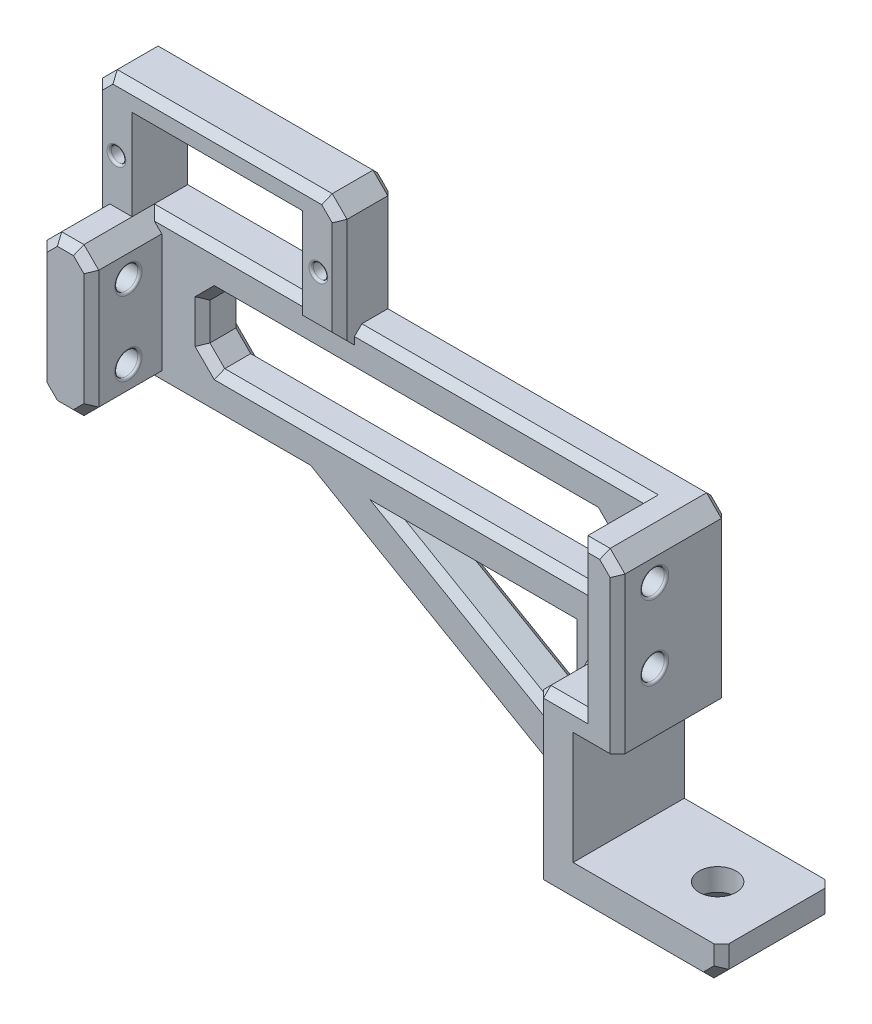
from build123d import *

# Parameters (mm, degrees)
RESSALTO_EXTRUS_O1_DEPTH  = 7.5
ESBO_O2_W                 = 33
ESBO_O2_H                 = 18.2
ESBO_O2_R                 = 0.975
ESBO_O2_W_2               = 23
ESBO_O2_H_2               = 12.2
RESSALTO_EXTRUS_O2_DEPTH  = 3
ESBO_O3_R                 = 0.975
RESSALTO_EXTRUS_O3_DEPTH  = 6
RESSALTO_EXTRUS_O4_DEPTH  = 1.5
ESBO_O6_R                 = 2.5
CORTE_EXTRUS_O1_DEPTH     = 9.5
CHANFRO1_SIZE             = 2
ESBO_O7_W                 = 15
ESBO_O7_H                 = 20
ESBO_O7_R                 = 1.6
RESSALTO_EXTRUS_O5_DEPTH  = 5
ESBO_O9_W                 = 12
ESBO_O9_H                 = 20
RESSALTO_EXTRUS_O6_DEPTH  = 2
ESBO_O10_W                = 12
ESBO_O10_H                = 20
ESBO_O10_R                = 1.55
RESSALTO_EXTRUS_O7_DEPTH  = 5
ESBO_O12_W                = 3
ESBO_O12_H                = 20
RESSALTO_EXTRUS_O11_DEPTH = 73
ESBO_O17_W                = 26
ESBO_O17_H                = 3
CORTE_EXTRUS_O2_DEPTH     = 4.5
ESBO_O18_R                = 0.975
RESSALTO_EXTRUS_O14_DEPTH = 4.5
ESBO_O19_W                = 55
ESBO_O19_H                = 9
CORTE_EXTRUS_O3_DEPTH     = 10
CHANFRO5_SIZE             = 2
RESSALTO_EXTRUS_O15_DEPTH = 3
RESSALTO_EXTRUS_O16_DEPTH = 2.5
CHANFRO8_SIZE             = 2
CHANFRO9_SIZE             = 2
CHANFRO10_SIZE            = 1
CHANFRO11_SIZE            = 1
FILETE1_R                 = 0.3


with BuildPart() as part:
    # Esboço1 → Ressalto-extrusão1 (new, symmetric)
    with BuildSketch(Plane.XY):
        Polygon((0, 0), (-6, 0), (-6, -15.2), (14, -15.2), (14, -20.2), (-11, -20.2), (-11, 3), (0, 3), align=None)
    extrude(amount=RESSALTO_EXTRUS_O1_DEPTH, both=True)

    # Esboço6 → Corte-extrusão1 (cut)
    with BuildSketch(Plane.XZ.offset(20.2)):
        with Locations((6, 0)):
            Circle(ESBO_O6_R)
    extrude(amount=-CORTE_EXTRUS_O1_DEPTH, mode=Mode.SUBTRACT)

    # Chanfro1
    chanfro1_edges = [part.edges().sort_by_distance(p)[0] for p in [
        (3.5, -20.2, 0),
    ]]
    chamfer(chanfro1_edges, length=CHANFRO1_SIZE)

    # Esboço7 → Ressalto-extrusão5 (add)
    with BuildSketch(Plane(origin=(0, 0, 0), x_dir=(0, 0, -1), z_dir=(1, 0, 0))):
        with Locations((0, 13)):
            Rectangle(ESBO_O7_W, ESBO_O7_H)
        with Locations(Location((-2.5, 18, 0), (0, 0, 90))):
            Circle(ESBO_O7_R, mode=Mode.SUBTRACT)
        with Locations(Location((-2.5, 8, 0), (0, 0, 90))):
            Circle(ESBO_O7_R, mode=Mode.SUBTRACT)
    extrude(amount=-RESSALTO_EXTRUS_O5_DEPTH)



with BuildPart() as body_2:
    # Esboço2 → Ressalto-extrusão2 (new body)
    with BuildSketch(Plane.XY.offset(-3)):
        with Locations((-61.5, 29.1)):
            Rectangle(ESBO_O2_W, ESBO_O2_H)
        with Locations((-75.125, 29.1)):
            Circle(ESBO_O2_R, mode=Mode.SUBTRACT)
        with Locations((-47.875, 29.1)):
            Circle(ESBO_O2_R, mode=Mode.SUBTRACT)
        with Locations((-61.5, 29.1)):
            Rectangle(ESBO_O2_W_2, ESBO_O2_H_2, mode=Mode.SUBTRACT)
    extrude(amount=RESSALTO_EXTRUS_O2_DEPTH)

    # Esboço3 → Ressalto-extrusão3 (add)
    # profile 1 of 2: a face of its own
    with BuildSketch(Plane.XY):
        Polygon((-75.125, 31.553738644), (-77.25, 30.326869322), (-77.25, 27.873130678), (-75.125, 26.646261356), (-73, 27.873130678), (-73, 30.326869322), align=None)
        with Locations((-75.125, 29.1)):
            Circle(ESBO_O3_R, mode=Mode.SUBTRACT)
    # profile 2 of 2: a face of its own
    with BuildSketch(Plane.XY):
        Polygon((-47.875, 31.553738644), (-50, 30.326869322), (-50, 27.873130678), (-47.875, 26.646261356), (-45.75, 27.873130678), (-45.75, 30.326869322), align=None)
        with Locations((-47.875, 29.1)):
            Circle(ESBO_O3_R, mode=Mode.SUBTRACT)
    extrude(amount=-RESSALTO_EXTRUS_O3_DEPTH)

    # Esboço4 → Ressalto-extrusão4 (add)
    with BuildSketch(Plane(origin=(0, 0, -6), x_dir=(-1, 0, 0), z_dir=(0, 0, -1))):
        Polygon((47.875, 31.553738644), (45.75, 30.326869322), (45.75, 27.873130678), (47.875, 26.646261356), (50, 27.873130678), (50, 30.326869322), align=None)
        Polygon((75.125, 31.553738644), (73, 30.326869322), (73, 27.873130678), (75.125, 26.646261356), (77.25, 27.873130678), (77.25, 30.326869322), align=None)
    extrude(amount=RESSALTO_EXTRUS_O4_DEPTH)

    # Esboço9 → Ressalto-extrusão6 (add)
    with BuildSketch(Plane(origin=(-78, 0, 0), x_dir=(0, 0, -1), z_dir=(1, 0, 0))):
        with Locations((-1.5, 13)):
            Rectangle(ESBO_O9_W, ESBO_O9_H)
    extrude(amount=RESSALTO_EXTRUS_O6_DEPTH)

    # Esboço10 → Ressalto-extrusão7 (add)
    with BuildSketch(Plane(origin=(-76, 0, 0), x_dir=(0, 0, -1), z_dir=(1, 0, 0))):
        with Locations((-1.5, 13)):
            Rectangle(ESBO_O10_W, ESBO_O10_H)
        with Locations((-2.5, 18)):
            Circle(ESBO_O10_R, mode=Mode.SUBTRACT)
        with Locations((-2.5, 8)):
            Circle(ESBO_O10_R, mode=Mode.SUBTRACT)
    extrude(amount=RESSALTO_EXTRUS_O7_DEPTH)


with BuildPart() as part_1:
    add(part.part)

    add(body_2.part)  # Ressalto-extrusão11 merges body 2
    # Esboço12 → Ressalto-extrusão11 (add)
    with BuildSketch(Plane(origin=(-78, 0, 0), x_dir=(0, 0, -1), z_dir=(1, 0, 0))):
        with Locations((6, 13)):
            Rectangle(ESBO_O12_W, ESBO_O12_H)
    extrude(amount=RESSALTO_EXTRUS_O11_DEPTH)

    # Esboço17 → Corte-extrusão2 (cut)
    with BuildSketch(Plane.XY):
        with Locations((-58, 21.5)):
            Rectangle(ESBO_O17_W, ESBO_O17_H)
    extrude(amount=-CORTE_EXTRUS_O2_DEPTH, mode=Mode.SUBTRACT)

    # Esboço18 → Ressalto-extrusão14 (add)
    with BuildSketch(Plane(origin=(0, 0, -3), x_dir=(-1, 0, 0), z_dir=(0, 0, -1))):
        Polygon((45, 38.2), (45, 23), (50, 23), (50, 30.326869322), (50, 35.2), (73, 35.2), (73, 30.326869322), (73, 23), (78, 23), (78, 38.2), align=None)
        with Locations(Location((75.125, 29.1, 0), (0, 0, 180))):
            Circle(ESBO_O18_R, mode=Mode.SUBTRACT)
        with Locations(Location((47.875, 29.1, 0), (0, 0, 180))):
            Circle(ESBO_O18_R, mode=Mode.SUBTRACT)
    extrude(amount=RESSALTO_EXTRUS_O14_DEPTH)

    # Esboço19 → Corte-extrusão3 (cut)
    with BuildSketch(Plane.XY.offset(-4.5)):
        with Locations((-38, 13)):
            Rectangle(ESBO_O19_W, ESBO_O19_H)
    extrude(amount=-CORTE_EXTRUS_O3_DEPTH, mode=Mode.SUBTRACT)

    # Chanfro5
    chanfro5_edges = [part_1.edges().sort_by_distance(p)[0] for p in [
        (-65.5, 17.5, -6),
        (-10.5, 17.5, -6),
        (-10.5, 8.5, -6),
        (-65.5, 8.5, -6),
    ]]
    chamfer(chanfro5_edges, length=CHANFRO5_SIZE)

    # Esboço20 → Ressalto-extrusão15 (add)
    with BuildSketch(Plane(origin=(0, 0, -7.5), x_dir=(-1, 0, 0), z_dir=(0, 0, -1))):
        Polygon((11, -20.2), (52.872328273, 3.975), (40.368017928, 3.683836287), (16, -10.385045424), (16, 3.116425339), (11, 3), align=None)
    extrude(amount=-RESSALTO_EXTRUS_O15_DEPTH)

    # Esboço21 → Ressalto-extrusão16 (add)
    with BuildSketch(Plane.XY.offset(-4.5)):
        Polygon((-5, 23), (-45, 23), (-50, 23), (-71, 23), (-71, 3), (-51.183578736, 3), (-11, -20.2), (-11, 3), (-5, 3), align=None)
        Polygon((-16, -10.385045424), (-16, 3), (-39.183578736, 3), align=None, mode=Mode.SUBTRACT)
        Polygon((-12.5, 17.5), (-10.5, 15.5), (-10.5, 10.5), (-12.5, 8.5), (-63.5, 8.5), (-65.5, 10.5), (-65.5, 15.5), (-63.5, 17.5), align=None, mode=Mode.SUBTRACT)
    extrude(amount=RESSALTO_EXTRUS_O16_DEPTH)

    # Chanfro8
    chanfro8_edges = [part_1.edges().sort_by_distance(p)[0] for p in [
        (-47.5, 23, -2),
        (-8, 3, -2),
    ]]
    chamfer(chanfro8_edges, length=CHANFRO8_SIZE - 0.0001)  # a hair under: the kernel refuses the full size

    # Chanfro9
    chanfro9_edges = [part_1.edges().sort_by_distance(p)[0] for p in [
        (14, -20.2, 0),
        (-71, 23, 2.75),
        (0, 23, 0),
        (-78, 3, 0),
        (-78, 23, 3.75),
        (-78, 38.2, -3.75),
        (-45, 38.2, -3.75),
        (-71, 3, 2.75),
    ]]
    chamfer(chanfro9_edges, length=CHANFRO9_SIZE - 0.0001)  # a hair under: the kernel refuses the full size

    # Chanfro10
    chanfro10_edges = [part_1.edges().sort_by_distance(p)[0] for p in [
        (0.50005, -20.2, -7.5),
        (0, 10.50005, -7.5),
        (-45, 29.60005, 0),
        (-11, -8.6, 7.5),
        (-11, 3, 3.74995),
        (-23.49995, 23, -7.5),
        (0.50005, -20.2, 7.5),
        (-38, 8.5, -7.5),
        (-65.5, 13, -7.5),
        (-38, 17.5, -7.5),
        (-10.5, 13, -7.5),
        (-64.5, 9.5, -7.5),
        (-64.5, 16.5, -7.5),
        (-11.5, 9.5, -7.5),
        (-11.5, 16.5, -7.5),
        (-27.591789368, 3, -7.5),
        (-63.591839368, 3, -7.5),
        (-31.091789368, -8.6, -7.5),
        (-27.591789368, -3.692522712, -7.5),
        (-16, -3.692522712, -7.5),
        (-25, 23, -2),
        (-61.49995, 23, -2),
        (-62.091739368, 3, -2),
        (-31.091789368, -8.6, -2),
        (-27.591789368, -3.692522712, -2),
        (-16, -3.692522712, -2),
        (-27.591789368, 3, -2),
        (-38, 17.5, -2),
        (-64.5, 16.5, -2),
        (-65.5, 13, -2),
        (-64.5, 9.5, -2),
        (-38, 8.5, -2),
        (-11.5, 9.5, -2),
        (-10.5, 13, -2),
        (-11.5, 16.5, -2),
        (-8, 3, 7.5),
        (-5, 13, 7.5),
        (-3.49995, 23, 7.5),
        (-78, 20.6, -7.5),
        (-78, 13, 7.5),
        (-78, 28.6001, 0),
        (-61.5, 38.2, -7.5),
        (-45, 29.60005, -7.5),
        (14, -16.70005, -7.5),
        (-0.99995, 22.00005, -7.5),
        (13.00005, -19.20005, -7.5),
        (-77.00005, 3.99995, -7.5),
        (-45.99995, 37.20005, -7.5),
        (-77.00005, 37.20005, -7.5),
        (-61.5, 38.2, 0),
        (-45.99995, 37.20005, 0),
        (-77.00005, 37.20005, 0),
        (-71, 13, 7.5),
        (-74.5, 3, 7.5),
        (-74.5, 23, 7.5),
        (-77.00005, 22.00005, 7.5),
        (-71.99995, 22.00005, 7.5),
        (-77.00005, 3.99995, 7.5),
        (-71.99995, 3.99995, 7.5),
        (14, -16.70005, 7.5),
        (-0.99995, 22.00005, 7.5),
        (13.00005, -19.20005, 7.5),
        (0, 10.50005, 7.5),
    ]]
    chamfer(chanfro10_edges, length=CHANFRO10_SIZE)

    # Chanfro11
    chanfro11_edges = [part_1.edges().sort_by_distance(p)[0] for p in [
        (-11, -20.2, 1.75),
    ]]
    chamfer(chanfro11_edges, length=CHANFRO11_SIZE)

    # Filete1
    filete1_edges = [part_1.edges().sort_by_distance(p)[0] for p in [
        (-5, 16.4, 2.5),
        (-5, 6.4, 2.5),
        (0, 6.4, 2.5),
        (0, 16.4, 2.5),
        (-76.1, 29.1, 0),
        (-48.85, 29.1, 0),
        (-71, 18, 4.05),
        (-71, 8, 4.05),
    ]]
    fillet(filete1_edges, radius=FILETE1_R)


solid = part_1.part
